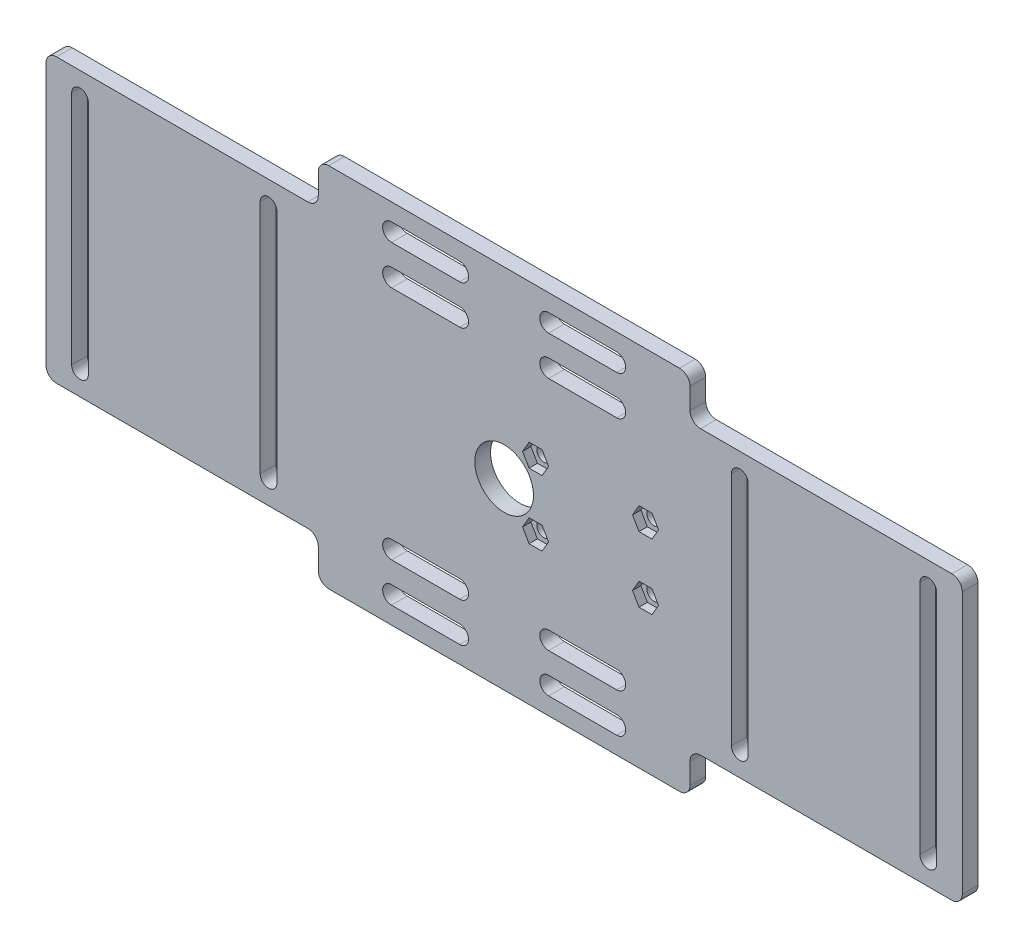
from build123d import *
from OCP.BRepFilletAPI import BRepFilletAPI_MakeChamfer
from build123d.topology import SkipClean

# Parameters (mm, degrees)
EXTRUDE_1_DEPTH     = 3
SKETCH_2_R          = 5.6
SKETCH_2_R_2        = 1.35
CUT_EXTRUDE_1_DEPTH = 95.288122264
CUT_EXTRUDE_2_DEPTH = 1.6
SKETCH_4_R          = 2.1
SKETCH_4_R_2        = 1.35
SKETCH_4_R_3        = 2
SKETCH_4_R_4        = 1.25
EXTRUDE_2_DEPTH     = 2
CHAMFER_1_SIZE      = 0.5
CHAMFER_1_SIZE2     = 0.288675135
FILLET_2_R          = 0.5


with BuildPart() as part:
    # 草圖1 → 填料-伸長1 (new body)
    with BuildSketch(Plane.XY):
        with BuildLine():
            Line((35.5, 33), (35.5, 29))
            ThreePointArc((35.5, 29), (36.085786438, 27.585786438), (37.5, 27))
            Line((37.5, 27), (85.5, 27))
            ThreePointArc((85.5, 27), (86.914213562, 26.414213562), (87.5, 25))
            Line((87.5, 25), (87.5, -25))
            ThreePointArc((87.5, -25), (86.914213562, -26.414213562), (85.5, -27))
            Line((85.5, -27), (37.5, -27))
            ThreePointArc((37.5, -27), (36.085786438, -27.585786438), (35.5, -29))
            Line((35.5, -29), (35.5, -33))
            ThreePointArc((35.5, -33), (34.914213562, -34.414213562), (33.5, -35))
            Line((33.5, -35), (-33.5, -35))
            ThreePointArc((-33.5, -35), (-34.914213562, -34.414213562), (-35.5, -33))
            Line((-35.5, -33), (-35.5, -29))
            ThreePointArc((-35.5, -29), (-36.085786438, -27.585786438), (-37.5, -27))
            Line((-37.5, -27), (-85.5, -27))
            ThreePointArc((-85.5, -27), (-86.914213562, -26.414213562), (-87.5, -25))
            Line((-87.5, -25), (-87.5, 25))
            ThreePointArc((-87.5, 25), (-86.914213562, 26.414213562), (-85.5, 27))
            Line((-85.5, 27), (-37.5, 27))
            ThreePointArc((-37.5, 27), (-36.085786438, 27.585786438), (-35.5, 29))
            Line((-35.5, 29), (-35.5, 33))
            ThreePointArc((-35.5, 33), (-34.914213562, 34.414213562), (-33.5, 35))
            Line((-33.5, 35), (33.5, 35))
            ThreePointArc((33.5, 35), (34.914213562, 34.414213562), (35.5, 33))
        make_face()
    extrude(amount=EXTRUDE_1_DEPTH)

    # 草圖2 → 除料-伸長1 (cut, through all)
    with BuildSketch(Plane.XY.offset(3)):
        Circle(SKETCH_2_R)
        with Locations((27, 6.25)):
            Circle(SKETCH_2_R_2)
        with Locations((6, 6.25)):
            Circle(SKETCH_2_R_2)
        with Locations((6, -6.25)):
            Circle(SKETCH_2_R_2)
        with Locations((27, -6.25)):
            Circle(SKETCH_2_R_2)
        with BuildLine():
            Line((43.4, -22.5), (43.4, 22.5))
            ThreePointArc((43.4, 22.5), (45, 24.1), (46.6, 22.5))
            Line((46.6, 22.5), (46.6, -22.5))
            ThreePointArc((46.6, -22.5), (45, -24.1), (43.4, -22.5))
        make_face()
        with BuildLine():
            Line((-46.6, -22.5), (-46.6, 22.5))
            ThreePointArc((-46.6, 22.5), (-45, 24.1), (-43.4, 22.5))
            Line((-43.4, 22.5), (-43.4, -22.5))
            ThreePointArc((-43.4, -22.5), (-45, -24.1), (-46.6, -22.5))
        make_face()
        with BuildLine():
            Line((-82.6, -22.5), (-82.6, 22.5))
            ThreePointArc((-82.6, 22.5), (-81, 24.1), (-79.4, 22.5))
            Line((-79.4, 22.5), (-79.4, -22.5))
            ThreePointArc((-79.4, -22.5), (-81, -24.1), (-82.6, -22.5))
        make_face()
        with BuildLine():
            Line((79.4, -22.5), (79.4, 22.5))
            ThreePointArc((79.4, 22.5), (81, 24.1), (82.6, 22.5))
            Line((82.6, 22.5), (82.6, -22.5))
            ThreePointArc((82.6, -22.5), (81, -24.1), (79.4, -22.5))
        make_face()
        with BuildLine():
            Line((21.5, -31.7), (8.5, -31.7))
            ThreePointArc((8.5, -31.7), (6.8, -30), (8.5, -28.3))
            Line((8.5, -28.3), (21.5, -28.3))
            ThreePointArc((21.5, -28.3), (23.2, -30), (21.5, -31.7))
        make_face()
        with BuildLine():
            Line((-21.5, -31.7), (-8.5, -31.7))
            ThreePointArc((-8.5, -31.7), (-6.8, -30), (-8.5, -28.3))
            Line((-8.5, -28.3), (-21.5, -28.3))
            ThreePointArc((-21.5, -28.3), (-23.2, -30), (-21.5, -31.7))
        make_face()
        with BuildLine():
            Line((21.5, 31.7), (8.5, 31.7))
            ThreePointArc((8.5, 31.7), (6.8, 30), (8.5, 28.3))
            Line((8.5, 28.3), (21.5, 28.3))
            ThreePointArc((21.5, 28.3), (23.2, 30), (21.5, 31.7))
        make_face()
        with BuildLine():
            Line((-21.5, 31.7), (-8.5, 31.7))
            ThreePointArc((-8.5, 31.7), (-6.8, 30), (-8.5, 28.3))
            Line((-8.5, 28.3), (-21.5, 28.3))
            ThreePointArc((-21.5, 28.3), (-23.2, 30), (-21.5, 31.7))
        make_face()
        with BuildLine():
            Line((21.5, 24.2), (8.5, 24.2))
            ThreePointArc((8.5, 24.2), (6.8, 22.5), (8.5, 20.8))
            Line((8.5, 20.8), (21.5, 20.8))
            ThreePointArc((21.5, 20.8), (23.2, 22.5), (21.5, 24.2))
        make_face()
        with BuildLine():
            Line((-21.5, 24.2), (-8.5, 24.2))
            ThreePointArc((-8.5, 24.2), (-6.8, 22.5), (-8.5, 20.8))
            Line((-8.5, 20.8), (-21.5, 20.8))
            ThreePointArc((-21.5, 20.8), (-23.2, 22.5), (-21.5, 24.2))
        make_face()
        with BuildLine():
            Line((-21.5, -24.2), (-8.5, -24.2))
            ThreePointArc((-8.5, -24.2), (-6.8, -22.5), (-8.5, -20.8))
            Line((-8.5, -20.8), (-21.5, -20.8))
            ThreePointArc((-21.5, -20.8), (-23.2, -22.5), (-21.5, -24.2))
        make_face()
        with BuildLine():
            Line((21.5, -24.2), (8.5, -24.2))
            ThreePointArc((8.5, -24.2), (6.8, -22.5), (8.5, -20.8))
            Line((8.5, -20.8), (21.5, -20.8))
            ThreePointArc((21.5, -20.8), (23.2, -22.5), (21.5, -24.2))
        make_face()
    extrude(amount=-CUT_EXTRUDE_1_DEPTH, mode=Mode.SUBTRACT)

    # 草圖3 → 除料-伸長2 (cut)
    with BuildSketch(Plane.XY.offset(3)):
        Polygon((29.482606158, -6.25), (28.241303079, -4.1), (25.758696921, -4.1), (24.517393842, -6.25), (25.758696921, -8.4), (28.241303079, -8.4), align=None)
        Polygon((8.482606158, -6.25), (7.241303079, -4.1), (4.758696921, -4.1), (3.517393842, -6.25), (4.758696921, -8.4), (7.241303079, -8.4), align=None)
        Polygon((29.482606158, 6.25), (28.241303079, 8.4), (25.758696921, 8.4), (24.517393842, 6.25), (25.758696921, 4.1), (28.241303079, 4.1), align=None)
        Polygon((8.482606158, 6.25), (7.241303079, 8.4), (4.758696921, 8.4), (3.517393842, 6.25), (4.758696921, 4.1), (7.241303079, 4.1), align=None)
    extrude(amount=-CUT_EXTRUDE_2_DEPTH, mode=Mode.SUBTRACT)

    # 草圖4 → 填料-伸長2 (add)
    # profile 1 of 4: a face of its own
    with SkipClean():  # the faces are left unmerged after this step: merging them gives an invalid solid
        with BuildSketch(Plane(origin=(0, 0, 0), x_dir=(-1, 0, 0), z_dir=(0, 0, -1))):
            with Locations((-27, 6.25)):
                Circle(SKETCH_4_R)
            with Locations((-27, 6.25)):
                Circle(SKETCH_4_R_2, mode=Mode.SUBTRACT)
        # profile 2 of 4: a face of its own
        with BuildSketch(Plane(origin=(0, 0, 0), x_dir=(-1, 0, 0), z_dir=(0, 0, -1))):
            with Locations((-27, -6.25)):
                Circle(SKETCH_4_R_3)
            with Locations((-27, -6.25)):
                Circle(SKETCH_4_R_4, mode=Mode.SUBTRACT)
        # profile 3 of 4: a face of its own
        with BuildSketch(Plane(origin=(0, 0, 0), x_dir=(-1, 0, 0), z_dir=(0, 0, -1))):
            with Locations((-6, 6.25)):
                Circle(SKETCH_4_R_3)
            with Locations((-6, 6.25)):
                Circle(SKETCH_4_R_4, mode=Mode.SUBTRACT)
        # profile 4 of 4: a face of its own
        with BuildSketch(Plane(origin=(0, 0, 0), x_dir=(-1, 0, 0), z_dir=(0, 0, -1))):
            with Locations((-6, -6.25)):
                Circle(SKETCH_4_R_3)
            with Locations((-6, -6.25)):
                Circle(SKETCH_4_R_4, mode=Mode.SUBTRACT)
        extrude(amount=EXTRUDE_2_DEPTH)

    # 導角1: one chamfer whose edges measure the first distance from different faces: ONE call of the kernel's chamfer builder (chamfer() names one face for all edges)
    chamfer_1_edges_1 = [part.edges().sort_by_distance(p)[0] for p in [
        (28.35, 6.25, -2),
    ]]
    chamfer_1_side_1 = [part.faces().sort_by_distance(p)[0] for p in [
        (29.04060303, 6.25, -2),
    ]]
    chamfer_1_edges_2 = [part.edges().sort_by_distance(p)[0] for p in [
        (7.25, 6.25, -2),
    ]]
    chamfer_1_side_2 = [part.faces().sort_by_distance(p)[0] for p in [
        (7.943431458, 6.25, -2),
    ]]
    chamfer_1_edges_3 = [part.edges().sort_by_distance(p)[0] for p in [
        (7.25, -6.25, -2),
    ]]
    chamfer_1_side_3 = [part.faces().sort_by_distance(p)[0] for p in [
        (7.943431458, -6.25, -2),
    ]]
    chamfer_1_edges_4 = [part.edges().sort_by_distance(p)[0] for p in [
        (28.25, -6.25, -2),
    ]]
    chamfer_1_side_4 = [part.faces().sort_by_distance(p)[0] for p in [
        (28.943431458, -6.25, -2),
    ]]
    chamfer_1 = BRepFilletAPI_MakeChamfer(part.part.solid().wrapped)
    for e in chamfer_1_edges_1:
        chamfer_1.Add(CHAMFER_1_SIZE, CHAMFER_1_SIZE2, e.wrapped, chamfer_1_side_1[0].wrapped)  # the first distance lies on this face
    for e in chamfer_1_edges_2:
        chamfer_1.Add(CHAMFER_1_SIZE, CHAMFER_1_SIZE2, e.wrapped, chamfer_1_side_2[0].wrapped)  # the first distance lies on this face
    for e in chamfer_1_edges_3:
        chamfer_1.Add(CHAMFER_1_SIZE, CHAMFER_1_SIZE2, e.wrapped, chamfer_1_side_3[0].wrapped)  # the first distance lies on this face
    for e in chamfer_1_edges_4:
        chamfer_1.Add(CHAMFER_1_SIZE, CHAMFER_1_SIZE2, e.wrapped, chamfer_1_side_4[0].wrapped)  # the first distance lies on this face
    add(Compound.cast(chamfer_1.Shape()), mode=Mode.REPLACE)

    # 圓角2
    fillet_2_edges = [part.edges().sort_by_distance(p)[0] for p in [
        (29.1, 6.25, 0),
        (8, 6.25, 0),
        (8, -6.25, 0),
        (29, -6.25, 0),
    ]]
    fillet(fillet_2_edges, radius=FILLET_2_R)


solid = part.part
